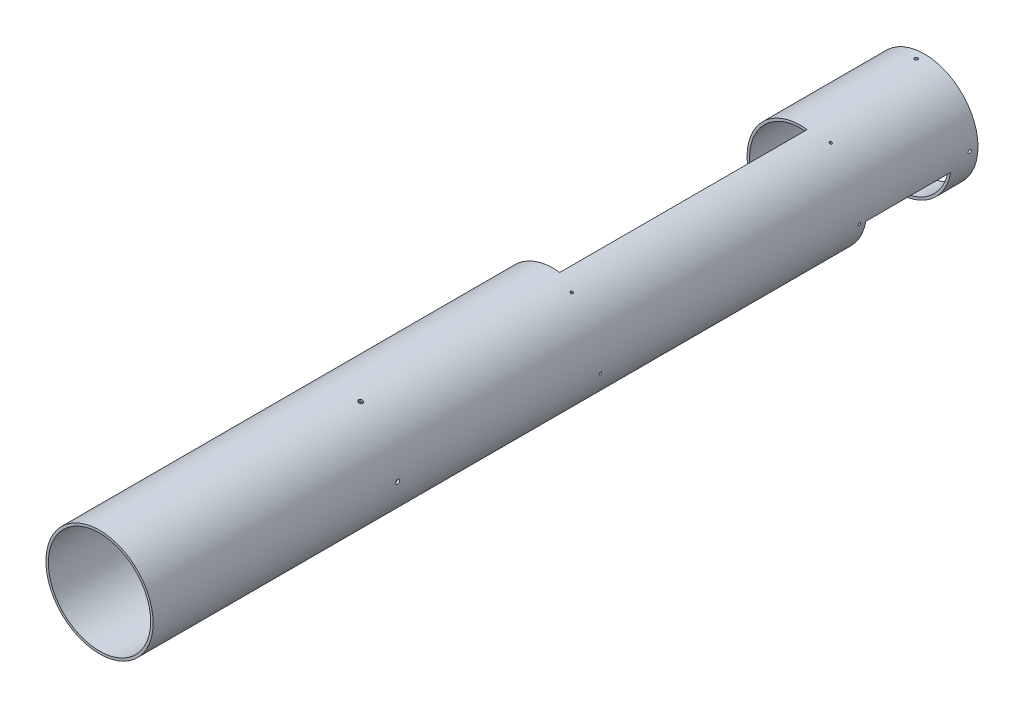
from build123d import *

# Parameters (mm, degrees)
SKETCH1_R           = 65
SKETCH1_R_2         = 62
BOSS_EXTRUDE1_DEPTH = 1000
SKETCH4_W           = 130
SKETCH4_H           = 300
CUT_EXTRUDE4_DEPTH  = 516
SKETCH5_R           = 2
CUT_EXTRUDE5_DEPTH  = 85
CIRPATTERN1_COUNT   = 4
SKETCH7_R           = 1.5
CUT_EXTRUDE6_DEPTH  = 243
CIRPATTERN2_COUNT   = 5
SKETCH8_R           = 2.5
CUT_EXTRUDE7_DEPTH  = 209
CIRPATTERN3_COUNT   = 5
CUT_EXTRUDE8_START  = -103
CUT_EXTRUDE8_DEPTH  = 103


with BuildPart() as part:
    # Sketch1 → Boss-Extrude1 (new body)
    with BuildSketch(Plane.XY):
        Circle(SKETCH1_R)
        Circle(SKETCH1_R_2, mode=Mode.SUBTRACT)
    extrude(amount=BOSS_EXTRUDE1_DEPTH)

    # Sketch4 → Cut-Extrude4 (cut)
    with BuildSketch(Plane(origin=(-28.284271247, 28.284271247, 0), x_dir=(0.7071067811865477, 0.7071067811865475, 0), z_dir=(-0.7071067811865475, 0.7071067811865477, 0))):
        with Locations((0, -300)):
            Rectangle(SKETCH4_W, SKETCH4_H)
    extrude(amount=CUT_EXTRUDE4_DEPTH, mode=Mode.SUBTRACT)

    # Sketch5 → Cut-Extrude5 (cut)
    with BuildSketch(Plane(origin=(0, 0, 0), x_dir=(1, 0, 0), z_dir=(0, 1, 0))):
        with Locations((0, -10)):
            Circle(SKETCH5_R)
    cut_extrude5 = extrude(amount=-CUT_EXTRUDE5_DEPTH, mode=Mode.SUBTRACT)

    # CirPattern1: Cut-Extrude5 ×4 about axis
    cirpattern1_axis = Axis((0, 0, 1000), (0, 0, -1))
    for i in range(1, CIRPATTERN1_COUNT):
        add(cut_extrude5.rotate(cirpattern1_axis, i * 360 / CIRPATTERN1_COUNT), mode=Mode.SUBTRACT)

    # Sketch7 → Cut-Extrude6 (cut)
    with BuildSketch(Plane(origin=(-28.284271247, 28.284271247, 0), x_dir=(0.7071067811865477, 0.7071067811865475, 0), z_dir=(-0.7071067811865475, 0.7071067811865477, 0))):
        with Locations((0, -143)):
            Circle(SKETCH7_R)
        with Locations((0, -457)):
            Circle(SKETCH7_R)
    cut_extrude6 = extrude(amount=CUT_EXTRUDE6_DEPTH, mode=Mode.SUBTRACT)

    # CirPattern2: Cut-Extrude6 ×5 about axis
    cirpattern2_axis = Axis((0, 0, 1000), (0, 0, -1))
    for i in range(1, CIRPATTERN2_COUNT):
        add(cut_extrude6.rotate(cirpattern2_axis, i * 360 / CIRPATTERN2_COUNT), mode=Mode.SUBTRACT)

    # Sketch8 → Cut-Extrude7 (cut)
    with BuildSketch(Plane(origin=(0, 0, 0), x_dir=(0, 0, -1), z_dir=(1, 0, 0))):
        with Locations((-703.5, 0)):
            Circle(SKETCH8_R)
    cut_extrude7 = extrude(amount=CUT_EXTRUDE7_DEPTH, mode=Mode.SUBTRACT)

    # CirPattern3: Cut-Extrude7 ×5 about axis
    cirpattern3_axis = Axis((0, 0, 1000), (0, 0, -1))
    for i in range(1, CIRPATTERN3_COUNT):
        add(cut_extrude7.rotate(cirpattern3_axis, i * 360 / CIRPATTERN3_COUNT), mode=Mode.SUBTRACT)

    # Sketch9 → Cut-Extrude8 (cut)
    with BuildSketch(Plane.XY.offset(135).offset(CUT_EXTRUDE8_START)):
        with BuildLine():
            Line((0, 0), (11.287131548, -64.012503946))
            ThreePointArc((11.287131548, -64.012503946), (45.961940777, -45.961940777), (64.012503946, -11.287131548))
            Line((64.012503946, -11.287131548), (0, 0))
        make_face()
    extrude(amount=CUT_EXTRUDE8_DEPTH, mode=Mode.SUBTRACT)


solid = part.part
